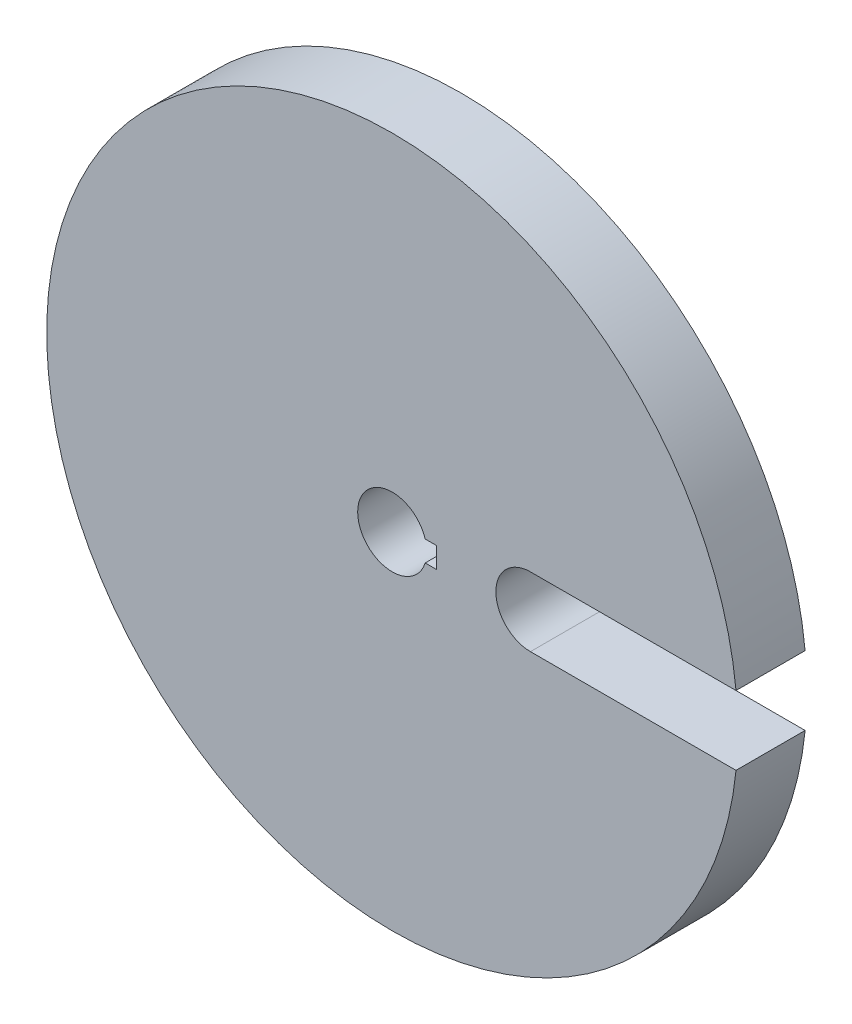
from build123d import *

# Parameters (mm, degrees)
SKETCH_1_R               = 50
EXTRUDE_1_DEPTH          = 10
SKETCH_2_R               = 5
CUT_EXTRUDE_1_DEPTH      = 72.414284285
CUT_EXTRUDE_START        = -1.5
CUT_EXTRUDE_12_OUTLINE_W = 2.4
CUT_EXTRUDE_12_OUTLINE_H = 10
CUT_EXTRUDE_12_DEPTH     = 3
CUT_EXTRUDE_13_DEPTH     = 72.414284285


# Read off the part's stored shape, not the designer's step: 切除-拉伸12
with BuildPart() as part:
    # 草图1 → 凸台-拉伸1 (new body)
    with BuildSketch(Plane.XY):
        Circle(SKETCH_1_R)
    extrude(amount=EXTRUDE_1_DEPTH)

    # 草图2 → 切除-拉伸1 (cut, through all)
    with BuildSketch(Plane.XY.offset(10)):
        Circle(SKETCH_2_R)
    extrude(amount=-CUT_EXTRUDE_1_DEPTH, mode=Mode.SUBTRACT)

    # 切除-拉伸12 outline → 切除-拉伸12 (cut)
    with BuildSketch(Plane(origin=(0, 0, 0), x_dir=(1, 0, 0), z_dir=(0, 1, 0)).offset(CUT_EXTRUDE_START)):
        with Locations((5.2, -5)):
            Rectangle(CUT_EXTRUDE_12_OUTLINE_W, CUT_EXTRUDE_12_OUTLINE_H)
    extrude(amount=CUT_EXTRUDE_12_DEPTH, mode=Mode.SUBTRACT)

    # 草图24 → 切除-拉伸13 (cut, through all)
    with BuildSketch(Plane.XY.offset(10)):
        with BuildLine():
            Line((20, -5), (50, -5))
            ThreePointArc((50, -5), (55, 0), (50, 5))
            Line((50, 5), (20, 5))
            ThreePointArc((20, 5), (15, 0), (20, -5))
        make_face()
    extrude(amount=-CUT_EXTRUDE_13_DEPTH, mode=Mode.SUBTRACT)


solid = part.part
